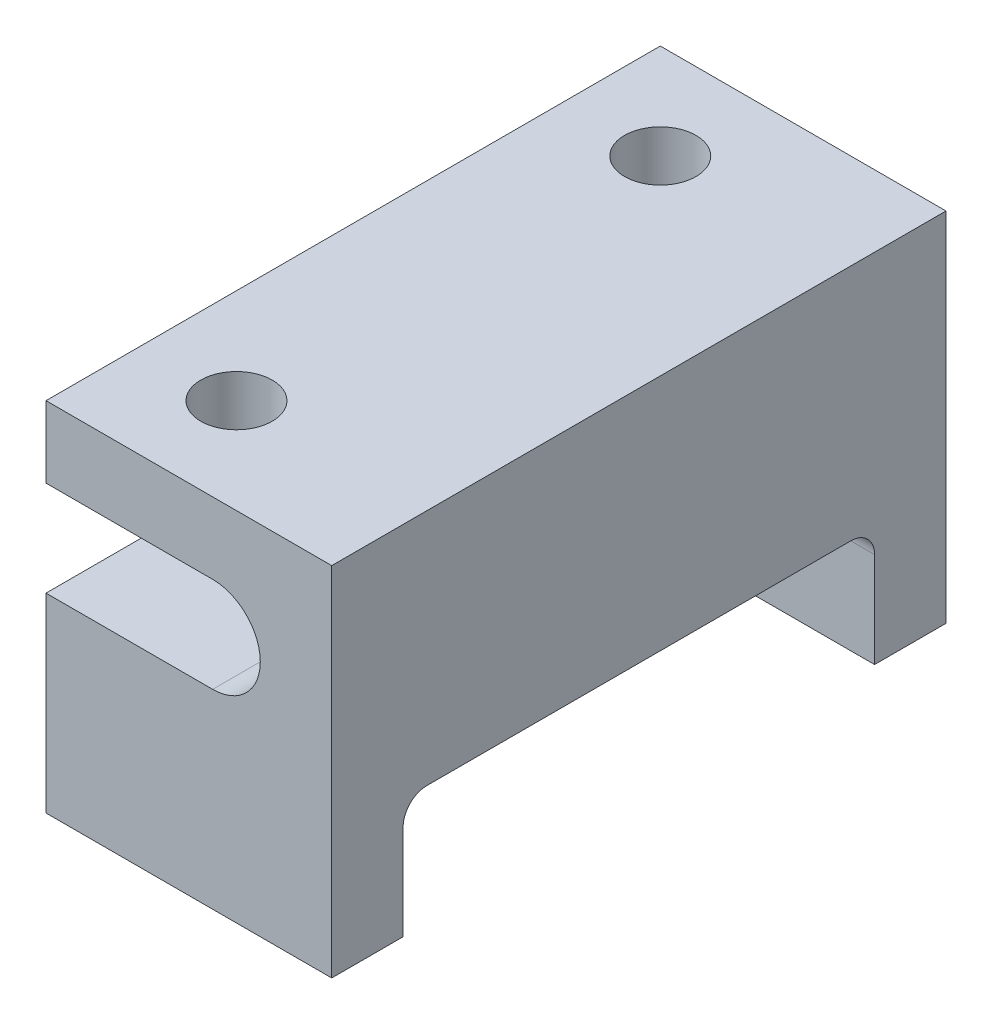
from build123d import *

# Parameters (mm, degrees)
BOSS_EXTRUDE1_DEPTH = 12.9
SKETCH2_W           = 3
SKETCH2_H           = 5
BOSS_EXTRUDE2_DEPTH = 12
SKETCH3_R           = 1.8
CUT_EXTRUDE1_DEPTH  = 5
FILLET1_R           = 2
FILLET2_R           = 1
SKETCH4_R           = 1.5
CUT_EXTRUDE2_DEPTH  = 3


with BuildPart() as part:
    # Sketch1 → Boss-Extrude1 (new, symmetric)
    with BuildSketch(Plane.XY):
        Polygon((0, 0), (9, 0), (9, -4), (0, -4), (0, -7), (12, -7), (12, 3), (0, 3), align=None)
    extrude(amount=BOSS_EXTRUDE1_DEPTH, both=True)

    # Sketch2 → Boss-Extrude2 (add, through all)
    with BuildSketch(Plane(origin=(12, 0, 0), x_dir=(0, 0, -1), z_dir=(1, 0, 0))):
        with Locations((-11.4, -9.5)):
            Rectangle(SKETCH2_W, SKETCH2_H)
        with Locations((11.4, -9.5)):
            Rectangle(SKETCH2_W, SKETCH2_H)
    extrude(amount=-BOSS_EXTRUDE2_DEPTH)

    # Sketch3 → Cut-Extrude1 (cut)
    with BuildSketch(Plane.XZ.offset(7)):
        with Locations((4, 0)):
            Circle(SKETCH3_R)
    extrude(amount=-CUT_EXTRUDE1_DEPTH, mode=Mode.SUBTRACT)

    # Fillet1
    fillet1_edges = [part.edges().sort_by_distance(p)[0] for p in [
        (9, -4, 0),
        (9, 0, 0),
    ]]
    fillet(fillet1_edges, radius=FILLET1_R - 0.0001)  # a hair under: the kernel refuses the full size

    # Fillet2
    fillet2_edges = [part.edges().sort_by_distance(p)[0] for p in [
        (6, -7, 9.9),
        (6, -7, -9.9),
    ]]
    fillet(fillet2_edges, radius=FILLET2_R)

    # Sketch4 → Cut-Extrude2 (cut)
    with BuildSketch(Plane(origin=(0, 3, 0), x_dir=(1, 0, 0), z_dir=(0, 1, 0))):
        with Locations(Location((4, 8.9, 0), (0, 0, 180))):
            Circle(SKETCH4_R)
        with Locations(Location((4, -8.9, 0), (0, 0, 180))):
            Circle(SKETCH4_R)
    extrude(amount=-CUT_EXTRUDE2_DEPTH, mode=Mode.SUBTRACT)


solid = part.part
